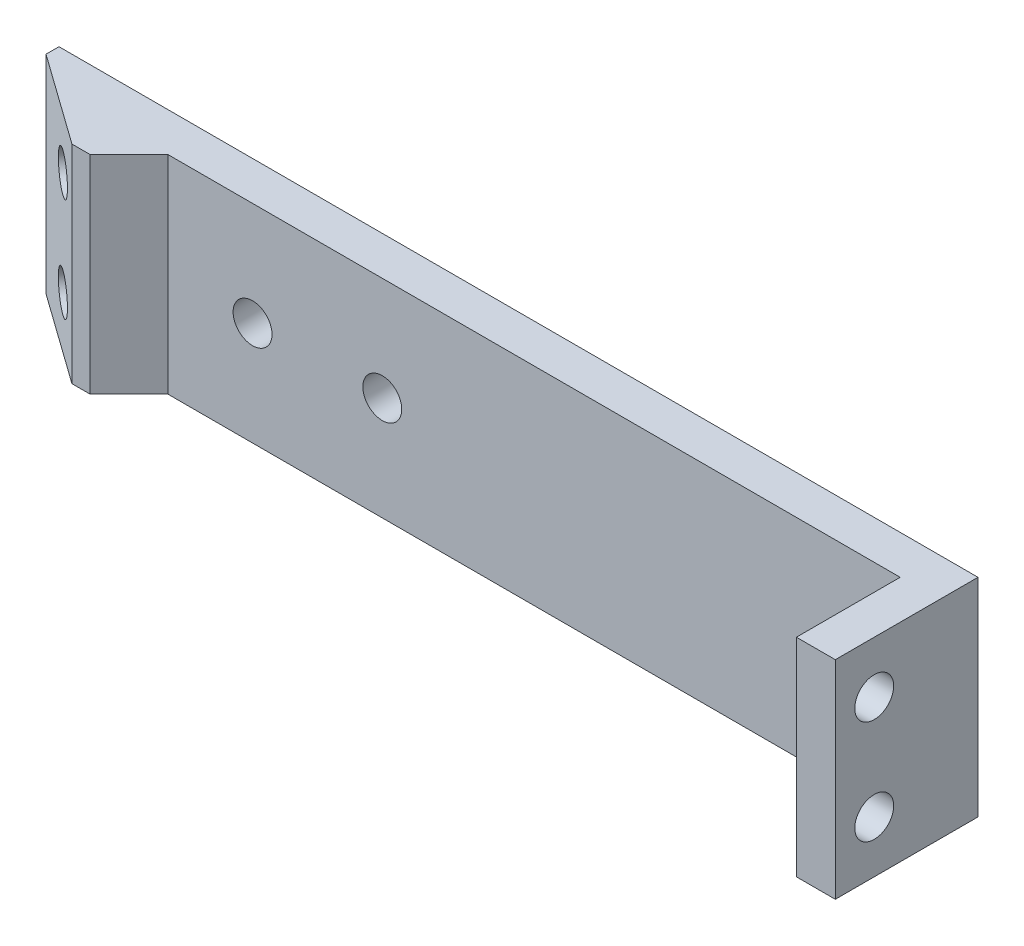
from build123d import *

# Parameters (mm, degrees)
SKETCH1_W           = 70.85
SKETCH1_H           = 16
BOSS_EXTRUDE1_DEPTH = 3
SKETCH2_W           = 8.4
SKETCH2_H           = 16
BOSS_EXTRUDE2_DEPTH = 3
CHAMFER1_SIZE       = 5
CHAMFER1_SIZE2      = 7
SKETCH3_R           = 1.5
CUT_EXTRUDE1_DEPTH  = 3
CHAMFER2_SIZE       = 3
CUT_EXTRUDE2_START  = -3
CUT_EXTRUDE2_DEPTH  = 8
SKETCH5_W           = 3
SKETCH5_H           = 16
BOSS_EXTRUDE3_DEPTH = 8
SKETCH6_R           = 1.5
CUT_EXTRUDE3_DEPTH  = 8
SKETCH7_R           = 1.5
CUT_EXTRUDE4_DEPTH  = 10
SKETCH8_R           = 1.5
CUT_EXTRUDE5_DEPTH  = 10


with BuildPart() as part:
    # Sketch1 → Boss-Extrude1 (new body)
    with BuildSketch(Plane.XY):
        Rectangle(SKETCH1_W, SKETCH1_H)
    extrude(amount=BOSS_EXTRUDE1_DEPTH)

    # Sketch2 → Boss-Extrude2 (add)
    with BuildSketch(Plane.XY.offset(3)):
        with Locations((-31.225, 0)):
            Rectangle(SKETCH2_W, SKETCH2_H)
    extrude(amount=BOSS_EXTRUDE2_DEPTH)

    # Chamfer1
    chamfer1_edges = [part.edges().sort_by_distance(p)[0] for p in [
        (-35.425, 0, 6),
    ]]
    chamfer1_side = [part.faces().sort_by_distance(p)[0] for p in [
        (-35.425, 0, 3),
    ]]
    chamfer(chamfer1_edges, length=CHAMFER1_SIZE, length2=CHAMFER1_SIZE2, reference=chamfer1_side[0])

    # Sketch3 → Cut-Extrude1 (cut)
    with BuildSketch(Plane(origin=(-12.440878378, 0, 17.41722973), x_dir=(0.8137334712067354, 0, 0.5812381937190957), z_dir=(-0.5812381937190957, 0, 0.8137334712067354))):
        with Locations((-22.642944757, 4)):
            Circle(SKETCH3_R)
        with Locations((-22.642944757, -4)):
            Circle(SKETCH3_R)
    extrude(amount=-CUT_EXTRUDE1_DEPTH, mode=Mode.SUBTRACT)

    # Chamfer2
    chamfer2_edges = [part.edges().sort_by_distance(p)[0] for p in [
        (-27.025, 0, 3),
    ]]
    chamfer(chamfer2_edges, length=CHAMFER2_SIZE - 0.0001)  # a hair under: the kernel refuses the full size

    # Sketch4 → Cut-Extrude2 (cut)
    with BuildSketch(Plane(origin=(-12.440878378, 0, 17.41722973), x_dir=(0.8137334712067354, 0, 0.5812381937190959), z_dir=(-0.5812381937190958, 0, 0.8137334712067353)).offset(CUT_EXTRUDE2_START)):
        Polygon((-19.467518276, 4), (-21.055231516, 6.75), (-24.230657997, 6.75), (-25.818371237, 4), (-24.230657997, 1.25), (-21.055231516, 1.25), align=None)
        Polygon((-19.467518276, -4), (-21.055231516, -1.25), (-24.230657997, -1.25), (-25.818371237, -4), (-24.230657997, -6.75), (-21.055231516, -6.75), align=None)
    extrude(amount=-CUT_EXTRUDE2_DEPTH, mode=Mode.SUBTRACT)

    # Sketch5 → Boss-Extrude3 (add)
    with BuildSketch(Plane.XY.offset(3)):
        with Locations((33.925, 0)):
            Rectangle(SKETCH5_W, SKETCH5_H)
    extrude(amount=BOSS_EXTRUDE3_DEPTH)

    # Sketch6 → Cut-Extrude3 (cut)
    with BuildSketch(Plane(origin=(35.425, 0, 0), x_dir=(0, 0, -1), z_dir=(1, 0, 0))):
        with Locations((-8, 4)):
            Circle(SKETCH6_R)
        with Locations((-8, -4)):
            Circle(SKETCH6_R)
    extrude(amount=-CUT_EXTRUDE3_DEPTH, mode=Mode.SUBTRACT)

    # Sketch7 → Cut-Extrude4 (cut)
    with BuildSketch(Plane(origin=(0, 0, 0), x_dir=(-1, 0, 0), z_dir=(0, 0, -1))):
        with Locations((17.5, 0)):
            Circle(SKETCH7_R)
    extrude(amount=-CUT_EXTRUDE4_DEPTH, mode=Mode.SUBTRACT)

    # Sketch8 → Cut-Extrude5 (cut)
    with BuildSketch(Plane.XY.offset(3)):
        with Locations((-7.5, 0)):
            Circle(SKETCH8_R)
    extrude(amount=-CUT_EXTRUDE5_DEPTH, mode=Mode.SUBTRACT)


solid = part.part
